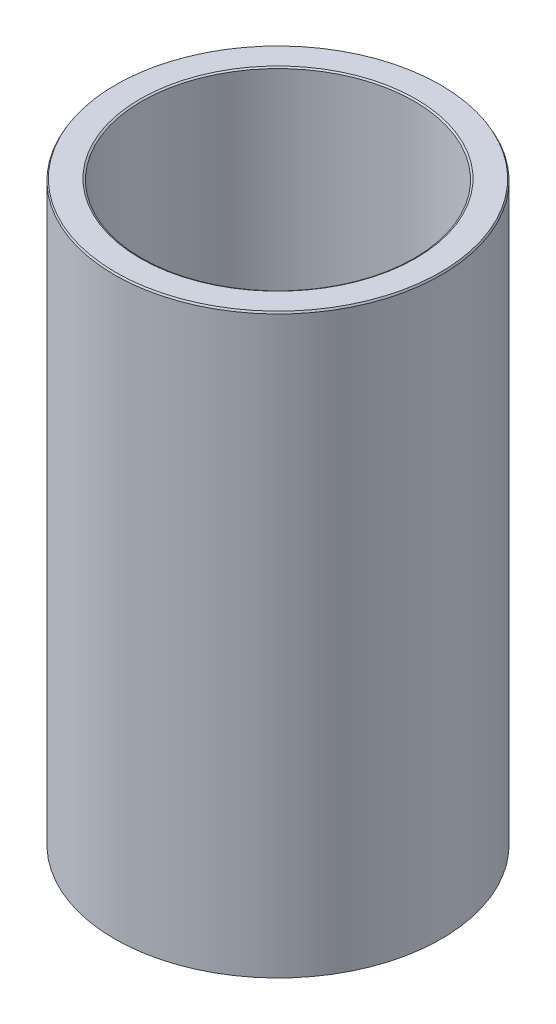
from build123d import *
from OCP.BRepFilletAPI import BRepFilletAPI_MakeChamfer

# Parameters (mm, degrees)
SKETCH1_R           = 45
BOSS_EXTRUDE1_DEPTH = 159.111934386
SKETCH2_R           = 37.498869652
CUT_EXTRUDE1_DEPTH  = 172.3668803
CHAMFER1_SIZE       = 0.481857137
CHAMFER1_SIZE2      = 0.278200348


with BuildPart() as part:
    # Sketch1 → Boss-Extrude1 (new body)
    with BuildSketch(Plane(origin=(0, 0, 0), x_dir=(1, 0, 0), z_dir=(0, 1, 0))):
        Circle(SKETCH1_R)
    extrude(amount=BOSS_EXTRUDE1_DEPTH)

    # Sketch2 → Cut-Extrude1 (cut, through all)
    with BuildSketch(Plane(origin=(0, 0, 0), x_dir=(1, 0, 0), z_dir=(0, 1, 0))):
        Circle(SKETCH2_R)
    extrude(amount=CUT_EXTRUDE1_DEPTH, mode=Mode.SUBTRACT)

    # Chamfer1: one chamfer whose edges measure the first distance from different faces: ONE call of the kernel's chamfer builder (chamfer() names one face for all edges)
    chamfer1_edges_1 = [part.edges().sort_by_distance(p)[0] for p in [
        (-37.498869652, 159.111934386, 0),
    ]]
    chamfer1_side_1 = [part.faces().sort_by_distance(p)[0] for p in [
        (-43.727207794, 159.111934386, 0),
    ]]
    chamfer1_edges_2 = [part.edges().sort_by_distance(p)[0] for p in [
        (-37.498869652, 0, 0),
    ]]
    chamfer1_side_2 = [part.faces().sort_by_distance(p)[0] for p in [
        (-37.498869652, 79.555967193, 0),
    ]]
    chamfer1_edges_3 = [part.edges().sort_by_distance(p)[0] for p in [
        (-45, 0, 0),
    ]]
    chamfer1_side_3 = [part.faces().sort_by_distance(p)[0] for p in [
        (-43.727207794, 0, 0),
    ]]
    chamfer1_edges_4 = [part.edges().sort_by_distance(p)[0] for p in [
        (-45, 159.111934386, 0),
    ]]
    chamfer1_side_4 = [part.faces().sort_by_distance(p)[0] for p in [
        (-45, 79.555967193, 0),
    ]]
    chamfer1 = BRepFilletAPI_MakeChamfer(part.part.solid().wrapped)
    for e in chamfer1_edges_1:
        chamfer1.Add(CHAMFER1_SIZE, CHAMFER1_SIZE2, e.wrapped, chamfer1_side_1[0].wrapped)  # the first distance lies on this face
    for e in chamfer1_edges_2:
        chamfer1.Add(CHAMFER1_SIZE, CHAMFER1_SIZE2, e.wrapped, chamfer1_side_2[0].wrapped)  # the first distance lies on this face
    for e in chamfer1_edges_3:
        chamfer1.Add(CHAMFER1_SIZE, CHAMFER1_SIZE2, e.wrapped, chamfer1_side_3[0].wrapped)  # the first distance lies on this face
    for e in chamfer1_edges_4:
        chamfer1.Add(CHAMFER1_SIZE, CHAMFER1_SIZE2, e.wrapped, chamfer1_side_4[0].wrapped)  # the first distance lies on this face
    add(Compound.cast(chamfer1.Shape()), mode=Mode.REPLACE)


solid = part.part
